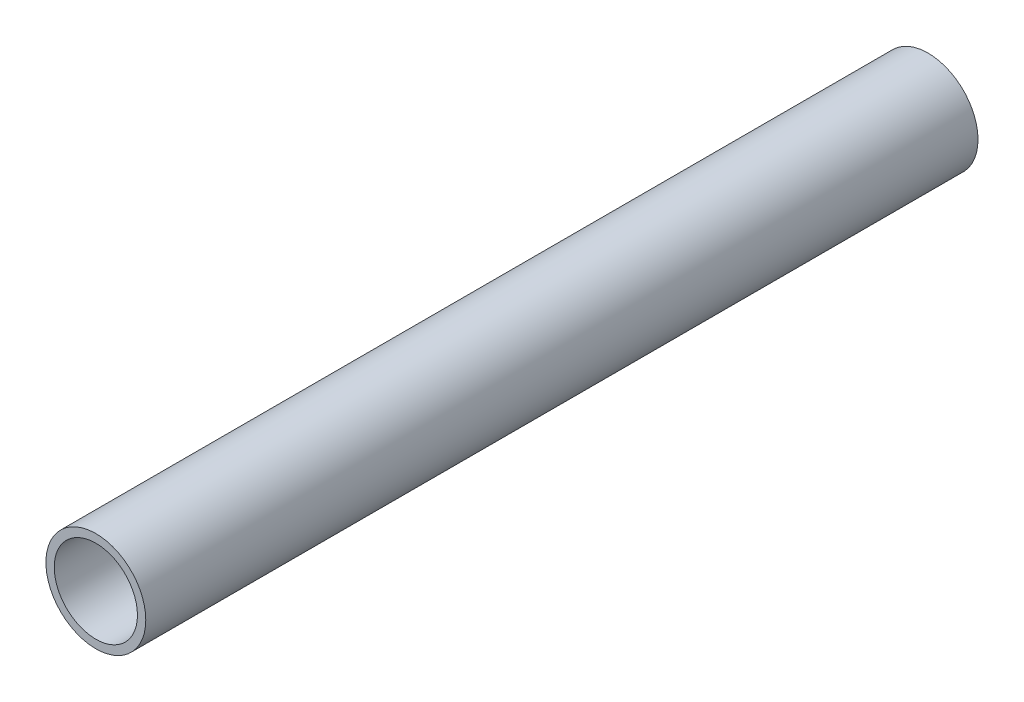
from build123d import *

# Parameters (mm, degrees)
SKETCH1_R           = 3
SKETCH1_R_2         = 2.5
BOSS_EXTRUDE1_DEPTH = 50


with BuildPart() as part:
    # Sketch1 → Boss-Extrude1 (new body)
    with BuildSketch(Plane.XY):
        Circle(SKETCH1_R)
        Circle(SKETCH1_R_2, mode=Mode.SUBTRACT)
    extrude(amount=BOSS_EXTRUDE1_DEPTH)


solid = part.part
